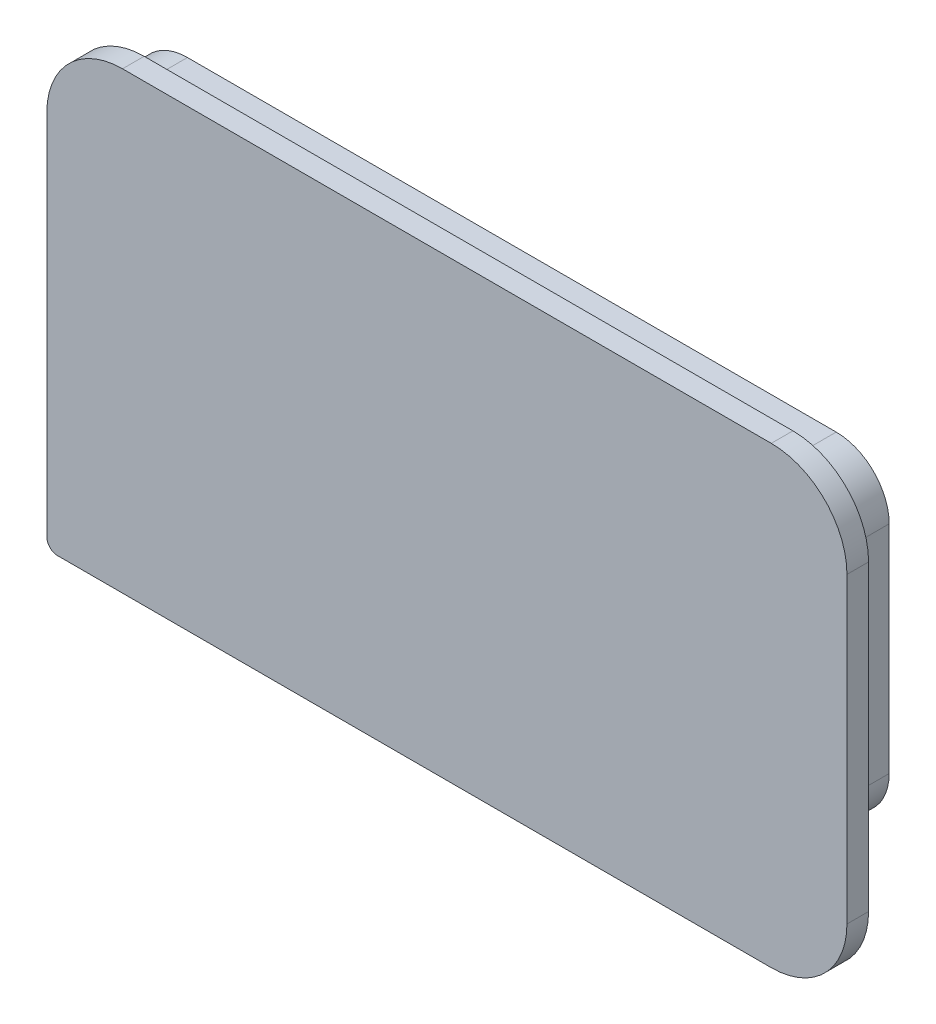
from build123d import *

# Parameters (mm, degrees)
SKETCH1_W           = 74
SKETCH1_H           = 42
BOSS_EXTRUDE1_DEPTH = 2
BOSS_EXTRUDE2_DEPTH = 5
FILLET2_R           = 5
FILLET3_R           = 5
FILLET4_R           = 7
CUT_EXTRUDE2_DEPTH  = 5
FILLET6_R           = 1


with BuildPart() as part:
    # Sketch1 → Boss-Extrude1 (new body)
    with BuildSketch(Plane.XY):
        Rectangle(SKETCH1_W, SKETCH1_H)
    extrude(amount=BOSS_EXTRUDE1_DEPTH)

    # Sketch2 → Boss-Extrude2 (add)
    with BuildSketch(Plane(origin=(0, 0, 0), x_dir=(-1, 0, 0), z_dir=(0, 0, -1))):
        Polygon((37, 21), (-37, 21), (-37, -21), (-5, -21), (-5, -11), (-35, -11), (-35, 19), (35, 19), (35, -21), (37, -21), align=None)
    extrude(amount=BOSS_EXTRUDE2_DEPTH)

    # Fillet2
    fillet2_edges = [part.edges().sort_by_distance(p)[0] for p in [
        (5, -11, -2.5),
        (35, -11, -2.5),
        (35, 19, -2.5),
        (-35, 19, -2.5),
    ]]
    fillet(fillet2_edges, radius=FILLET2_R)

    # Fillet3
    fillet3_edges = [part.edges().sort_by_distance(p)[0] for p in [
        (5, -18.5, 0),
        (6.464466094, -12.464466094, 0),
        (20, -11, 0),
        (33.535533906, -9.535533906, 0),
        (35, 4, 0),
        (33.535533906, 17.535533906, 0),
        (-35, -3.5, 0),
        (-33.535533906, 17.535533906, 0),
        (0, 19, 0),
    ]]
    fillet(fillet3_edges, radius=FILLET3_R - 0.0001)  # a hair under: the kernel refuses the full size

    # Fillet4
    fillet4_edges = [part.edges().sort_by_distance(p)[0] for p in [
        (-37, 21, -1.5),
        (37, 21, -1.5),
        (37, -21, -1.5),
    ]]
    fillet(fillet4_edges, radius=FILLET4_R)

    # Sketch3 → Cut-Extrude2 (cut)
    with BuildSketch(Plane(origin=(0, 0, 0), x_dir=(-1, 0, 0), z_dir=(0, 0, -1))):
        with BuildLine():
            Line((37.1, 21.1), (-37.1, 21.1))
            Line((-37.1, 21.1), (-37.1, -21.1))
            Line((-37.1, -21.1), (-6, -21.1))
            ThreePointArc((-6, -21.1), (-5.222182541, -20.777817459), (-4.9, -20))
            Line((-4.9, -20), (-4.9, -16))
            ThreePointArc((-4.9, -16), (-6.393755416, -12.393755416), (-10, -10.9))
            Line((-10, -10.9), (-30, -10.9))
            ThreePointArc((-30, -10.9), (-33.464823228, -9.464823228), (-34.9, -6))
            Line((-34.9, -6), (-34.9, 14))
            ThreePointArc((-34.9, 14), (-33.464823228, 17.464823228), (-30, 18.9))
            Line((-30, 18.9), (30, 18.9))
            ThreePointArc((30, 18.9), (33.464823228, 17.464823228), (34.9, 14))
            Line((34.9, 14), (34.9, -20))
            ThreePointArc((34.9, -20), (35.222182541, -20.777817459), (36, -21.1))
            Line((36, -21.1), (37.1, -21.1))
            Line((37.1, -21.1), (37.1, 21.1))
        make_face()
    extrude(amount=CUT_EXTRUDE2_DEPTH, mode=Mode.SUBTRACT)

    # Fillet6
    fillet6_edges = [part.edges().sort_by_distance(p)[0] for p in [
        (-37, -21, 1),
    ]]
    fillet(fillet6_edges, radius=FILLET6_R)


solid = part.part
